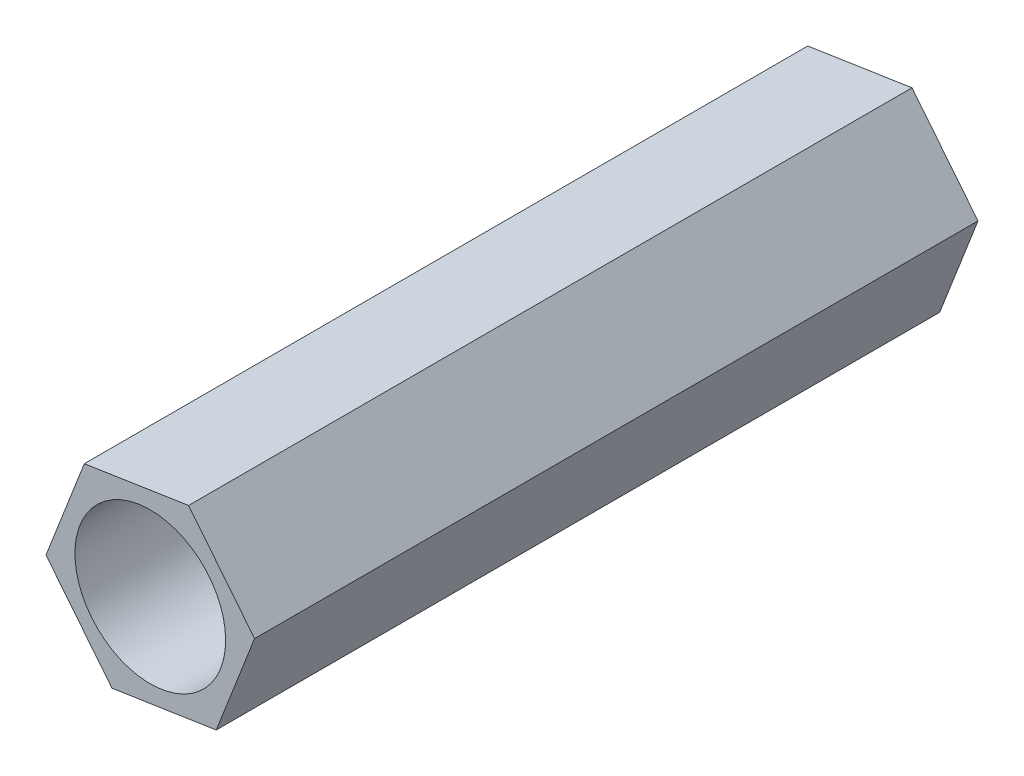
from build123d import *

# Parameters (mm, degrees)
SKETCH1_R           = 1.75
SKETCH1_R_2         = 1.25
BOSS_EXTRUDE1_DEPTH = 12
CUT_EXTRUDE2_START  = -12
CUT_EXTRUDE2_DEPTH  = 12


with BuildPart() as part:
    # Sketch1 → Boss-Extrude1 (new body)
    with BuildSketch(Plane.XY):
        Circle(SKETCH1_R)
        Circle(SKETCH1_R_2, mode=Mode.SUBTRACT)
    extrude(amount=BOSS_EXTRUDE1_DEPTH)

    # Sketch2 → Cut-Extrude2 (cut)
    with BuildSketch(Plane.XY.offset(12).offset(CUT_EXTRUDE2_START)):
        with BuildLine():
            ThreePointArc((-0.635483942, -1.630539837), (0.264924681, -1.729830892), (1.09434695, -1.365615156))
            Line((1.09434695, -1.365615156), (-0.635483942, -1.630539837))
        make_face()
        with BuildLine():
            Line((1.729830892, 0.264924681), (1.09434695, -1.365615156))
            ThreePointArc((1.09434695, -1.365615156), (1.630539837, -0.635483942), (1.729830892, 0.264924681))
        make_face()
        with BuildLine():
            Line((0.635483942, 1.630539837), (1.729830892, 0.264924681))
            ThreePointArc((1.729830892, 0.264924681), (1.365615156, 1.09434695), (0.635483942, 1.630539837))
        make_face()
        with BuildLine():
            ThreePointArc((-1.729830892, -0.264924681), (-1.365615156, -1.09434695), (-0.635483942, -1.630539837))
            Line((-0.635483942, -1.630539837), (-1.729830892, -0.264924681))
        make_face()
        with BuildLine():
            Line((-1.09434695, 1.365615156), (0.635483942, 1.630539837))
            ThreePointArc((0.635483942, 1.630539837), (-0.264924681, 1.729830892), (-1.09434695, 1.365615156))
        make_face()
        with BuildLine():
            ThreePointArc((-1.09434695, 1.365615156), (-1.630539837, 0.635483942), (-1.729830892, -0.264924681))
            Line((-1.729830892, -0.264924681), (-1.09434695, 1.365615156))
        make_face()
    extrude(amount=CUT_EXTRUDE2_DEPTH, mode=Mode.SUBTRACT)


solid = part.part
